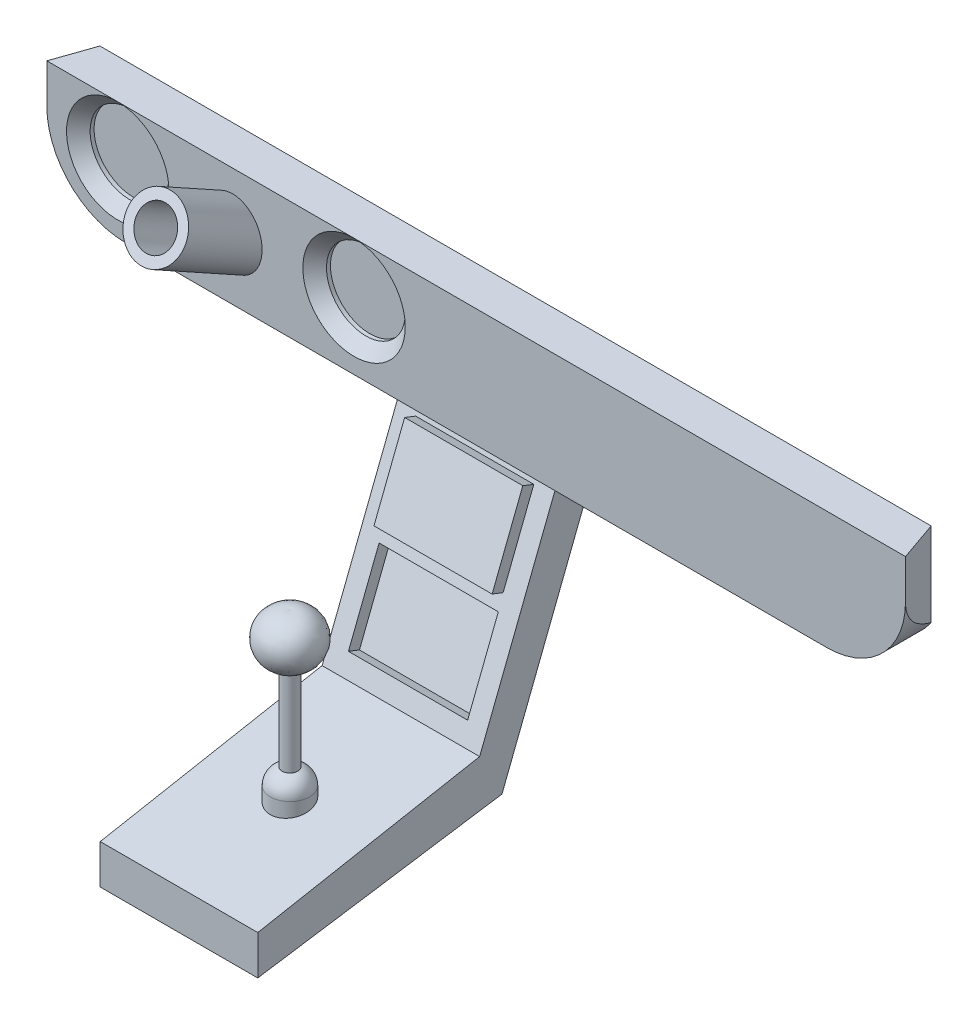
from build123d import *

# Parameters (mm, degrees)
SKETCH1_W           = 218
SKETCH1_H           = 30
BOSS_EXTRUDE1_DEPTH = 5
FILLET1_R           = 20
SKETCH2_R           = 10
CUT_EXTRUDE2_DEPTH  = 4
CHAMFER1_SIZE       = 3
SKETCH4_R           = 5
CUT_EXTRUDE3_DEPTH  = 119.159523594
BOSS_EXTRUDE4_DEPTH = 20
SKETCH7_W           = 30
SKETCH7_H           = 21.4
BOSS_EXTRUDE6_DEPTH = 3
SKETCH12_W          = 30.262484152
SKETCH12_H          = 21.4
CUT_EXTRUDE6_DEPTH  = 3
CUT_EXTRUDE7_DEPTH  = 40
CUT_EXTRUDE9_DEPTH  = 40


with BuildPart() as part:
    # Sketch1 → Boss-Extrude1 (new, symmetric)
    with BuildSketch(Plane.XY):
        Rectangle(SKETCH1_W, SKETCH1_H)
    extrude(amount=BOSS_EXTRUDE1_DEPTH, both=True)

    # Fillet1
    fillet1_edges = [part.edges().sort_by_distance(p)[0] for p in [
        (109, -15, 0),
        (-109, -15, 0),
    ]]
    fillet(fillet1_edges, radius=FILLET1_R)

    # Sketch2 → Cut-Extrude2 (cut)
    with BuildSketch(Plane.XY.offset(5)):
        with Locations((-91, 2)):
            Circle(SKETCH2_R)
        with Locations((-31, 2)):
            Circle(SKETCH2_R)
    extrude(amount=-CUT_EXTRUDE2_DEPTH, mode=Mode.SUBTRACT)

    # Chamfer1
    chamfer1_edges = [part.edges().sort_by_distance(p)[0] for p in [
        (-101, 2, 5),
        (-41, 2, 5),
    ]]
    chamfer(chamfer1_edges, length=CHAMFER1_SIZE - 0.0001)  # a hair under: the kernel refuses the full size

    # Sketch3 → Revolve1 (revolve)
    with BuildSketch(Plane(origin=(-61.85, 0, 0), x_dir=(0, 0, -1), z_dir=(1, 0, 0)), mode=Mode.PRIVATE) as revolve1_sk:
        Polygon((-20.856554777, 18.13092454), (-24.491559772, 11.570685315), (8.651987636, -6.794035278), (12.286992632, -0.233796053), align=None)
    revolve(revolve1_sk.sketch.rotate(Axis((-61.85, 11.570685315, 24.491559772), (0, -0.48466733269062345, -0.8746985632905524)), 180), axis=Axis((-61.85, 11.570685315, 24.491559772), (0, -0.48466733269062345, -0.8746985632905524)))

    # Sketch4 → Cut-Extrude3 (cut, through all)
    with BuildSketch(Plane(origin=(0, 13.100880469, 23.643684133), x_dir=(1, 0, 0), z_dir=(0, 0.48466733269062356, 0.8746985632905525))):
        with Locations(Location((-61.85, -1.749397127, 0), (0, 0, 270))):
            Circle(SKETCH4_R)
    extrude(amount=-CUT_EXTRUDE3_DEPTH, mode=Mode.SUBTRACT)

    # Sketch5 → Boss-Extrude4 (add, symmetric)
    with BuildSketch(Plane(origin=(0, 0, 0), x_dir=(0, 0, -1), z_dir=(1, 0, 0))):
        Polygon((5, -15), (-5, -15), (-24.115322554, -63.915136607), (-80.44712563, -74.437688296), (-80.44712563, -84.437688296), (-18.44712563, -75), align=None)
    extrude(amount=BOSS_EXTRUDE4_DEPTH, both=True)

    # Sketch7 → Boss-Extrude6 (add)
    with BuildSketch(Plane(origin=(0, -0.292155586, -0.747611262), x_dir=(1, 0, 0), z_dir=(0, 0.3639801648731982, 0.9314066993418502))):
        with Locations((0, -27.490001314)):
            Rectangle(SKETCH7_W, SKETCH7_H)
    extrude(amount=BOSS_EXTRUDE6_DEPTH)

    # Sketch12 → Cut-Extrude6 (cut)
    with BuildSketch(Plane(origin=(0, -0.292155586, -0.747611262), x_dir=(1, 0, 0), z_dir=(0, 0.3639801648731982, 0.9314066993418502))):
        with Locations((0, -52.608485504)):
            Rectangle(SKETCH12_W, SKETCH12_H)
    extrude(amount=-CUT_EXTRUDE6_DEPTH, mode=Mode.SUBTRACT)

    # Sketch16 → Revolve2 (revolve)
    with BuildSketch(Plane(origin=(0, 0, 0), x_dir=(0, 0, -1), z_dir=(1, 0, 0)), mode=Mode.PRIVATE) as revolve2_sk:
        with BuildLine():
            Line((-52.272833575, -27.565753671), (-52.272833575, -91.206271932))
            Line((-52.272833575, -91.206271932), (-44.772833575, -91.206271932))
            Line((-44.772833575, -91.206271932), (-44.772833575, -81.206271932))
            Line((-44.772833575, -81.206271932), (-47.272833575, -81.206271932))
            Line((-47.272833575, -81.206271932), (-47.272833575, -66.206271932))
            ThreePointArc((-47.272833575, -66.206271932), (-48.101213981, -63.643814293), (-50.272833575, -62.051183895))
            Line((-50.272833575, -62.051183895), (-50.272833575, -39.90745984))
            ThreePointArc((-50.272833575, -39.90745984), (-45.10198049, -32.736606756), (-52.272833575, -27.565753671))
        make_face()
    revolve(revolve2_sk.sketch.rotate(Axis((0, -19.401017973, 52.272833575), (0, -1, 0)), 180), axis=Axis((0, -19.401017973, 52.272833575), (0, -1, 0)))

    # Sketch17 → Cut-Extrude7 (cut)
    with BuildSketch(Plane(origin=(0, 15, 0), x_dir=(1, 0, 0), z_dir=(0, 1, 0))):
        Polygon((-109, 5), (-109, -5), (-105.52, 5), align=None)
    extrude(amount=-CUT_EXTRUDE7_DEPTH, mode=Mode.SUBTRACT)

    # Sketch19 → Cut-Extrude9 (cut)
    with BuildSketch(Plane(origin=(0, 15, 0), x_dir=(1, 0, 0), z_dir=(0, 1, 0))):
        Polygon((109, 5), (105.52, 5), (109, -5), align=None)
    extrude(amount=-CUT_EXTRUDE9_DEPTH, mode=Mode.SUBTRACT)


solid = part.part
